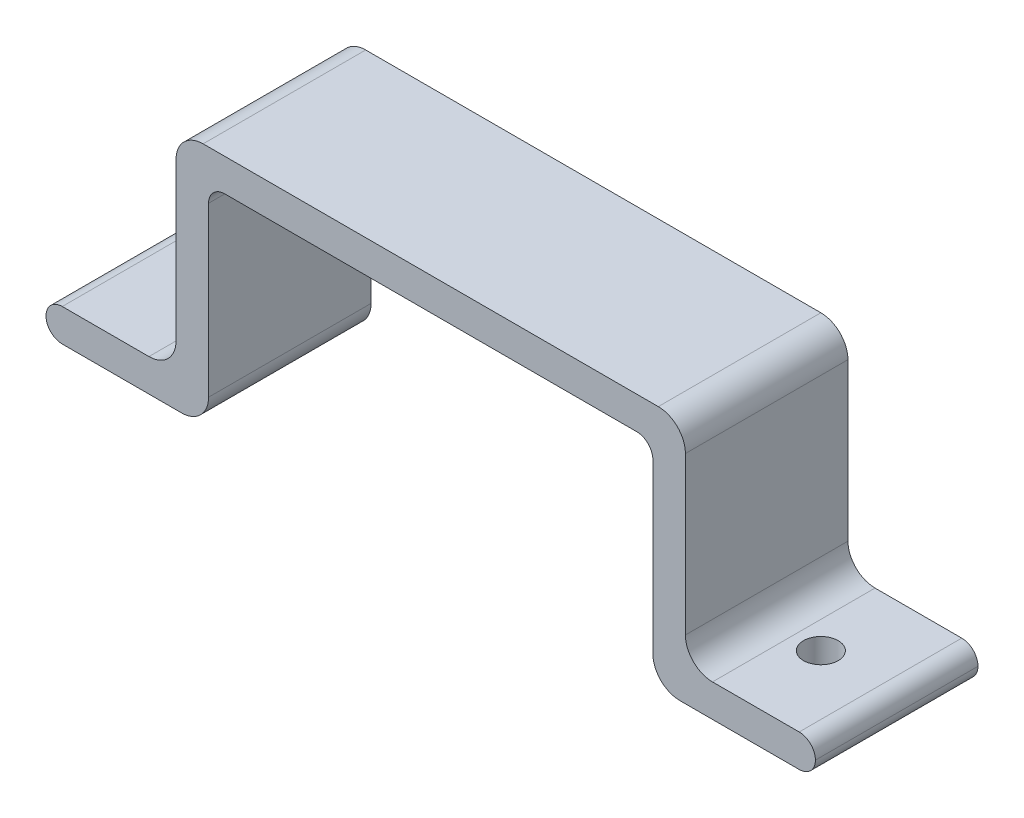
from build123d import *

# Parameters (mm, degrees)
BOSS_EXTRUDE1_DEPTH = 7.5
SKETCH2_R           = 1.6
CUT_EXTRUDE2_DEPTH  = 42.191625362
FILLET1_R           = 2.5
FILLET2_R           = 1.5


with BuildPart() as part:
    # Sketch1 → Boss-Extrude1 (new, symmetric)
    with BuildSketch(Plane.XY):
        Polygon((-23.5, 12.75), (23.5, 12.75), (23.5, -6.75), (35.5, -6.75), (35.5, -9.75), (20.5, -9.75), (20.5, 9.75), (-20.5, 9.75), (-20.5, -9.75), (-35.5, -9.75), (-35.5, -6.75), (-23.5, -6.75), align=None)
    extrude(amount=BOSS_EXTRUDE1_DEPTH, both=True)

    # Sketch2 → Cut-Extrude2 (cut, through all)
    with BuildSketch(Plane(origin=(0, -6.75, 0), x_dir=(1, 0, 0), z_dir=(0, 1, 0))):
        with Locations(Location((-28.5, 0, 0), (0, 0, 270))):
            Circle(SKETCH2_R)
        with Locations(Location((28.5, 0, 0), (0, 0, 270))):
            Circle(SKETCH2_R)
    extrude(amount=-CUT_EXTRUDE2_DEPTH, mode=Mode.SUBTRACT)

    # Fillet1
    fillet1_edges = [part.edges().sort_by_distance(p)[0] for p in [
        (23.5, -6.75, 0),
        (20.5, -9.75, 0),
        (-20.5, -9.75, 0),
        (-23.5, -6.75, 0),
        (-23.5, 12.75, 0),
        (23.5, 12.75, 0),
    ]]
    fillet(fillet1_edges, radius=FILLET1_R)

    # Fillet2
    fillet2_edges = [part.edges().sort_by_distance(p)[0] for p in [
        (35.5, -6.75, 0),
        (35.5, -9.75, 0),
        (20.5, 9.75, 0),
        (-20.5, 9.75, 0),
        (-35.5, -9.75, 0),
        (-35.5, -6.75, 0),
    ]]
    fillet(fillet2_edges, radius=FILLET2_R - 0.0001)  # a hair under: the kernel refuses the full size


solid = part.part
